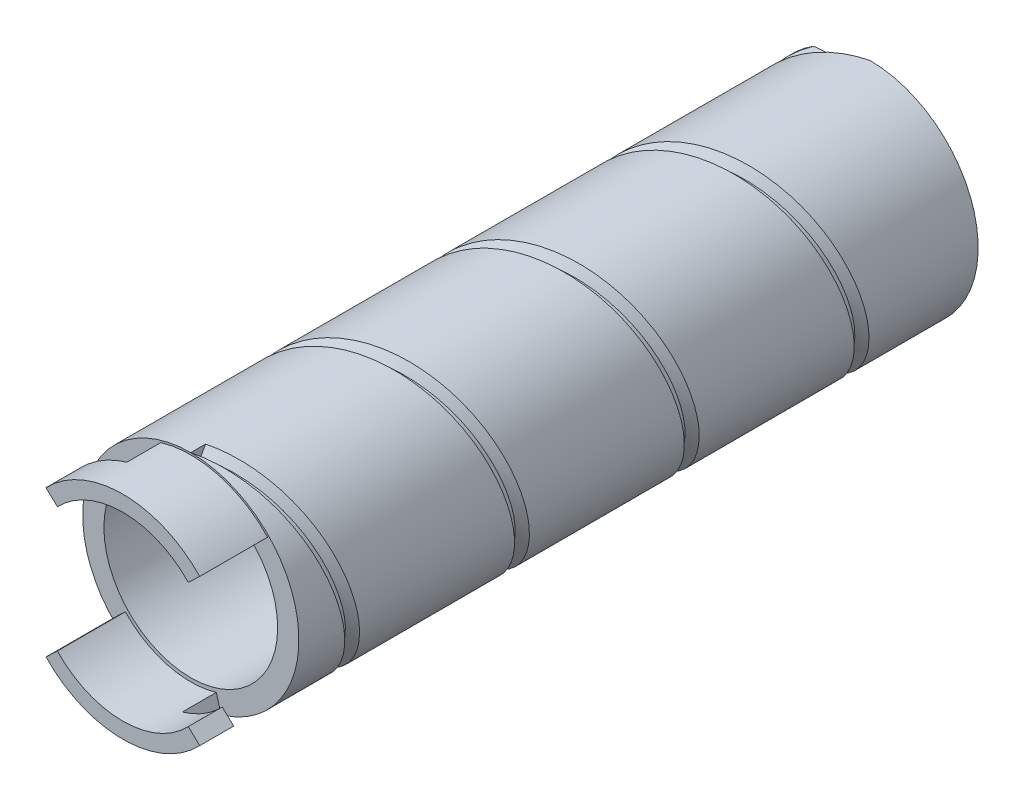
from build123d import *

# Parameters (mm, degrees)
SKETCH1_R           = 9.55
SKETCH1_R_2         = 7.674526848
BOSS_EXTRUDE1_DEPTH = 60
THREAD1_PITCH       = 15
BOSS_EXTRUDE3_DEPTH = 6
SKETCH10_W          = 1.875473152
SKETCH10_H          = 3
CUT_REVOLVE1_ANGLE  = 30
SKETCH11_W          = 2.034680347
SKETCH11_H          = 3.007772342
CUT_REVOLVE2_ANGLE  = 30
SKETCH13_R          = 7.993070603
CUT_EXTRUDE3_DEPTH  = 6
CUT_EXTRUDE4_START  = -6
SKETCH17_R          = 9.55
SKETCH17_R_2        = 9.380989251
CUT_EXTRUDE4_DEPTH  = 6


with BuildPart() as part:
    # Sketch1 → Boss-Extrude1 (new body)
    with BuildSketch(Plane(origin=(0, 0, 0), x_dir=(0, 1, 0), z_dir=(0, 0, 1))):
        with Locations(Location((0, 0, 0), (0, 0, 270))):
            Circle(SKETCH1_R)
        with Locations(Location((0, 0, 0), (0, 0, 270))):
            Circle(SKETCH1_R_2, mode=Mode.SUBTRACT)
    extrude(amount=BOSS_EXTRUDE1_DEPTH)

    # Thread1: arcs per turn and ends read off the stored shape
    # Thread1: the profile of Thread Profile2 profile screwed along a right-hand helix through 4 turns, 18 arcs to a turn; built about Z, then put on its axis
    thread1_z = Axis((0, 0, 0), (0, 0, 1))
    thread1_corners = [(9.5503, 0, -60.000173205), (9.5503, 0, -58.687326799), (8.738101188, 0, -59.156250002), (8.738101188, 0, -59.531250002)]
    with BuildLine(mode=Mode.PRIVATE) as thread1_profile:
        Line(thread1_corners[0], thread1_corners[1])
        Line(thread1_corners[1], thread1_corners[2])
        Line(thread1_corners[2], thread1_corners[3])
        Line(thread1_corners[3], thread1_corners[0])
    thread1_cap = Face(thread1_profile.wire())
    thread1_turn_angles = [0, 10, 20, 30, 40, 50, 60, 70, 80, 90, 100, 110, 120, 130, 140, 150, 160, 170, 180, 190, 200, 210, 220, 230, 240, 250, 260, 270, 280, 290, 300, 310, 320, 330, 340, 350, 360]
    thread1_turn_weights = [1, 0.984807753012208, 1, 0.984807753012208, 1, 0.984807753012208, 1, 0.984807753012208, 1, 0.984807753012208, 1, 0.984807753012208, 1, 0.984807753012208, 1, 0.984807753012208, 1, 0.984807753012208, 1, 0.984807753012208, 1, 0.984807753012208, 1, 0.984807753012208, 1, 0.984807753012208, 1, 0.984807753012208, 1, 0.984807753012208, 1, 0.984807753012208, 1, 0.984807753012208, 1, 0.984807753012208, 1]
    thread1_turn_rails = [Edge.make_bspline([Vector(p[0], p[1], 0).rotate(thread1_z, thread1_turn_angles[k]) / thread1_turn_weights[k] + Vector(0, 0, p[2] + THREAD1_PITCH * thread1_turn_angles[k] / 360) for k in range(37)], [0, 0, 0, 1, 1, 2, 2, 3, 3, 4, 4, 5, 5, 6, 6, 7, 7, 8, 8, 9, 9, 10, 10, 11, 11, 12, 12, 13, 13, 14, 14, 15, 15, 16, 16, 17, 17, 18, 18, 18], 2, thread1_turn_weights) for p in thread1_corners]
    thread1_turn_sides = [Face.make_surface_from_curves(thread1_turn_rails[p[0]], thread1_turn_rails[p[1]]) for p in [(0, 1), (1, 2), (2, 3), (3, 0)]]
    thread1 = Plane(origin=(0, 0, 0), x_dir=(0, 1, 0), z_dir=(0, 0, -1)) * Solid(Shell([*[p.moved(Location((0, 0, THREAD1_PITCH * i))) for i in range(4) for p in thread1_turn_sides], thread1_cap, thread1_cap.rotate(thread1_z, 1440).moved(Location((0, 0, THREAD1_PITCH * 1440 / 360)))]))
    add(thread1, mode=Mode.SUBTRACT)

    # Sketch9 → Boss-Extrude3 (add)
    with BuildSketch(Plane.XY.offset(60)):
        with BuildLine():
            Line((-6.910559575, 6.591408526), (-5.553431936, 5.296957246))
            ThreePointArc((-5.553431936, 5.296957246), (0, 7.674526848), (5.553431936, 5.296957246))
            Line((5.553431936, 5.296957246), (6.910559575, 6.591408526))
            ThreePointArc((6.910559575, 6.591408526), (0, 9.55), (-6.910559575, 6.591408526))
        make_face()
        with BuildLine():
            Line((-6.910559575, -6.591408526), (-5.553431936, -5.296957246))
            ThreePointArc((-5.553431936, -5.296957246), (0, -7.674526848), (5.553431936, -5.296957246))
            Line((5.553431936, -5.296957246), (6.910559575, -6.591408526))
            ThreePointArc((6.910559575, -6.591408526), (0, -9.55), (-6.910559575, -6.591408526))
        make_face()
    extrude(amount=BOSS_EXTRUDE3_DEPTH)

    # Sketch10 → Cut-Revolve1 (revolve, cut)
    with BuildSketch(Plane(origin=(0, 0, 0), x_dir=(-0.7236188036513711, 0.6901998456984458, 0), z_dir=(0.6901998456984458, 0.7236188036513711, 0))):
        with Locations((-8.612263424, 61.5)):
            Rectangle(SKETCH10_W, SKETCH10_H)
    revolve(axis=Axis((0, 0, -4.472078647), (0, 0, -1)), revolution_arc=CUT_REVOLVE1_ANGLE, mode=Mode.SUBTRACT)

    # Sketch11 → Cut-Revolve2 (revolve, cut)
    with BuildSketch(Plane(origin=(0, 0, 0), x_dir=(0.7236188036513712, -0.6901998456984458, 0), z_dir=(-0.6901998456984458, -0.7236188036513712, 0))):
        with Locations((-8.691867022, 61.503886171)):
            Rectangle(SKETCH11_W, SKETCH11_H)
    revolve(axis=Axis((0, 0, -4.011698912), (0, 0, -1)), revolution_arc=CUT_REVOLVE2_ANGLE, mode=Mode.SUBTRACT)

    # Sketch13 → Cut-Extrude3 (cut)
    with BuildSketch(Plane.XY.offset(66)):
        Circle(SKETCH13_R)
    extrude(amount=-CUT_EXTRUDE3_DEPTH, mode=Mode.SUBTRACT)

    # Sketch17 → Cut-Extrude4 (cut)
    with BuildSketch(Plane(origin=(0, 0, 66), x_dir=(0, -1, 0), z_dir=(0, 0, 1)).offset(CUT_EXTRUDE4_START)):
        Circle(SKETCH17_R)
        Circle(SKETCH17_R_2, mode=Mode.SUBTRACT)
    extrude(amount=CUT_EXTRUDE4_DEPTH, mode=Mode.SUBTRACT)


solid = part.part
